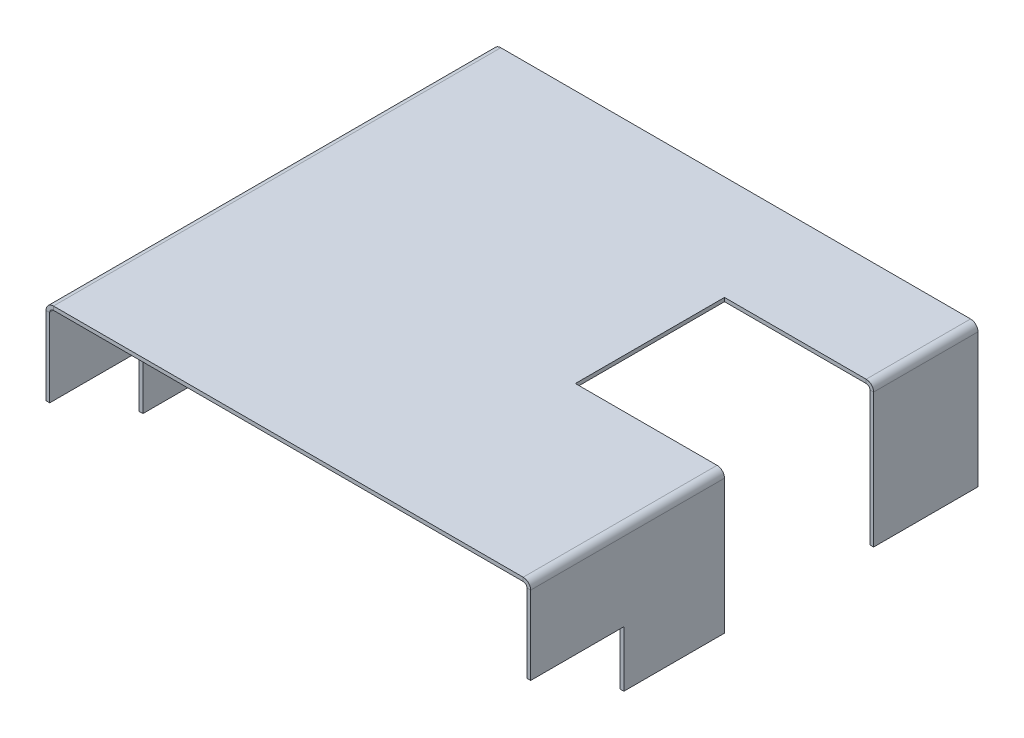
from build123d import *

# Parameters (mm, degrees)
BOSS_EXTRUDE1_DEPTH    = 152.4
CONVERT_SOLID1_START   = -152.4
CONVERT_SOLID1_DEPTH   = 152.4
CONVERT_SOLID1_2_DEPTH = 152.4
SKETCH6_W              = 60.654765258
SKETCH6_H              = 35.589797731
CUT_EXTRUDE1_DEPTH     = 230.810351377
SKETCH7_W              = 82.570052287
SKETCH7_H              = 50.8
CUT_EXTRUDE2_DEPTH     = 180.914674499


# Read off the part's stored shape, not the designer's step: Convert-Solid1
with BuildPart() as part:
    # Sketch1 → Boss-Extrude1 (new body)
    with BuildSketch(Plane.XY):
        Polygon((-82.55, 0), (-82.55, 48.26), (82.55, 48.26), (82.55, 0), (81.28, 0), (81.28, 46.99), (-81.28, 46.99), (-81.28, 0), align=None)
    extrude(amount=-BOSS_EXTRUDE1_DEPTH)

    # Convert-Solid1 outline → Convert-Solid1 (cut)
    with BuildSketch(Plane.XY.offset(CONVERT_SOLID1_START)):
        with BuildLine():
            Line((82.55, 48.26), (80.01, 48.26))
            ThreePointArc((80.01, 48.26), (81.806051224, 47.516051224), (82.55, 45.72))
            Line((82.55, 45.72), (82.55, 48.26))
        make_face()
        with BuildLine():
            ThreePointArc((-82.55, 45.72), (-81.806051224, 47.516051224), (-80.01, 48.26))
            Line((-80.01, 48.26), (-82.55, 48.26))
            Line((-82.55, 48.26), (-82.55, 45.72))
        make_face()
    extrude(amount=CONVERT_SOLID1_DEPTH, mode=Mode.SUBTRACT)

    # Convert-Solid1 2 outline → Convert-Solid1 2 (add)
    with BuildSketch(Plane.XY.offset(CONVERT_SOLID1_START)):
        with BuildLine():
            Line((81.28, 46.99), (80.01, 46.99))
            ThreePointArc((80.01, 46.99), (80.908025612, 46.618025612), (81.28, 45.72))
            Line((81.28, 45.72), (81.28, 46.99))
        make_face()
        with BuildLine():
            ThreePointArc((-81.28, 45.72), (-80.908025612, 46.618025612), (-80.01, 46.99))
            Line((-80.01, 46.99), (-81.28, 46.99))
            Line((-81.28, 46.99), (-81.28, 45.72))
        make_face()
    extrude(amount=CONVERT_SOLID1_2_DEPTH)

    # Sketch6 → Cut-Extrude1 (cut, through all)
    with BuildSketch(Plane.ZY.offset(82.55)):
        with Locations((-1.422617371, 1.255101135)):
            Rectangle(SKETCH6_W, SKETCH6_H)
    extrude(amount=-CUT_EXTRUDE1_DEPTH, mode=Mode.SUBTRACT)

    # Sketch7 → Cut-Extrude2 (cut, through all)
    with BuildSketch(Plane(origin=(0, 48.26, 0), x_dir=(1, 0, 0), z_dir=(0, 1, 0))):
        with Locations((73.035026144, 91.44)):
            Rectangle(SKETCH7_W, SKETCH7_H)
    extrude(amount=-CUT_EXTRUDE2_DEPTH, mode=Mode.SUBTRACT)


solid = part.part
